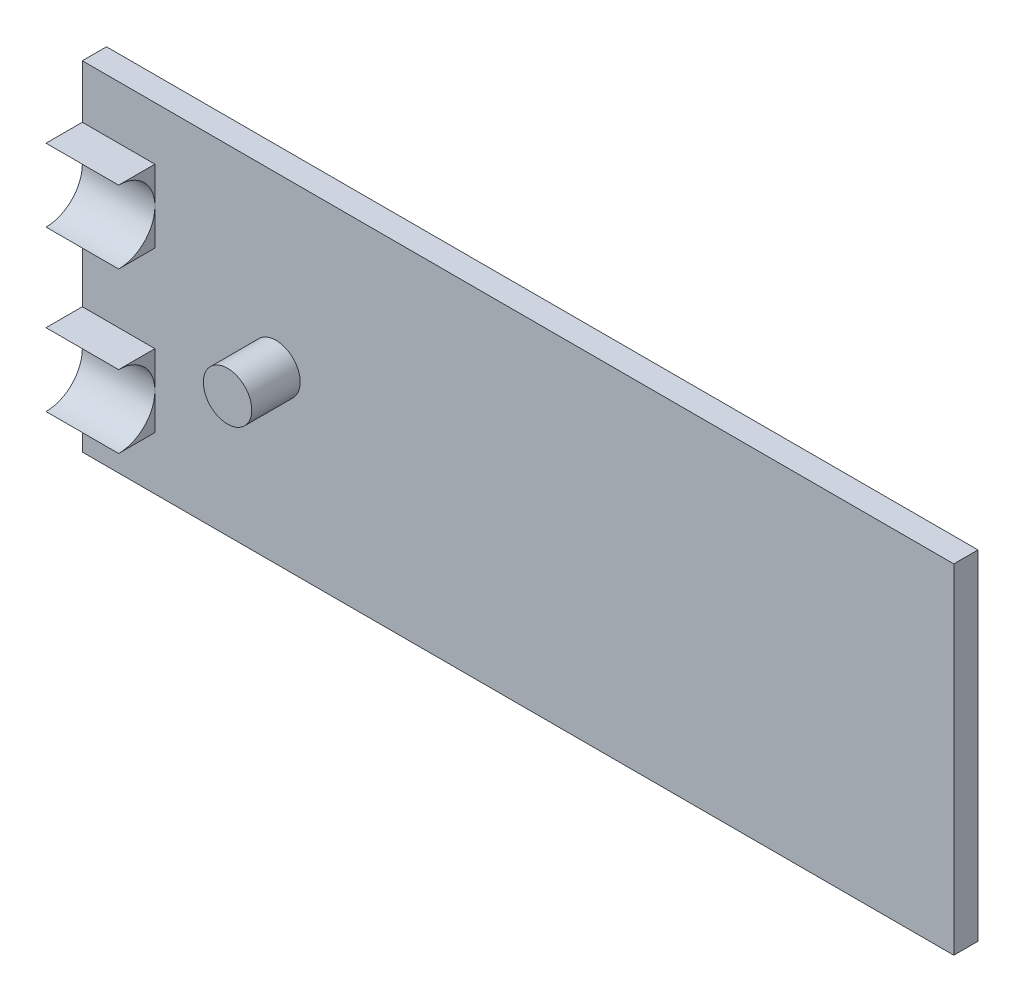
from build123d import *

# Parameters (mm, degrees)
ESBO_O1_W                = 180
ESBO_O1_H                = 70
RESSALTO_EXTRUS_O1_DEPTH = 5
RESSALTO_EXTRUS_O2_DEPTH = 15
ESBO_O3_R                = 5
RESSALTO_EXTRUS_O3_DEPTH = 10


with BuildPart() as part:
    # Esboço1 → Ressalto-extrusão1 (new body)
    with BuildSketch(Plane.XY):
        Rectangle(ESBO_O1_W, ESBO_O1_H)
    extrude(amount=RESSALTO_EXTRUS_O1_DEPTH)

    # Esboço2 → Ressalto-extrusão2 (add)
    with BuildSketch(Plane.ZY.offset(90)):
        with BuildLine():
            ThreePointArc((5, 16.5), (7.196699141, 21.803300859), (12.5, 24))
            Line((12.5, 24), (5, 24))
            Line((5, 24), (5, 16.5))
        make_face()
        with BuildLine():
            ThreePointArc((12.5, -24), (7.196699141, -21.803300859), (5, -16.5))
            Line((5, -16.5), (5, -24))
            Line((5, -24), (12.5, -24))
        make_face()
        with BuildLine():
            Line((12.5, -9), (5, -9))
            Line((5, -9), (5, -16.5))
            ThreePointArc((5, -16.5), (7.196699141, -11.196699141), (12.5, -9))
        make_face()
        with BuildLine():
            ThreePointArc((12.5, 9), (7.196699141, 11.196699141), (5, 16.5))
            Line((5, 16.5), (5, 9))
            Line((5, 9), (12.5, 9))
        make_face()
    extrude(amount=-RESSALTO_EXTRUS_O2_DEPTH)

    # Esboço3 → Ressalto-extrusão3 (add)
    with BuildSketch(Plane.XY.offset(5)):
        with Locations((-50, 0)):
            Circle(ESBO_O3_R)
    extrude(amount=RESSALTO_EXTRUS_O3_DEPTH)


solid = part.part
